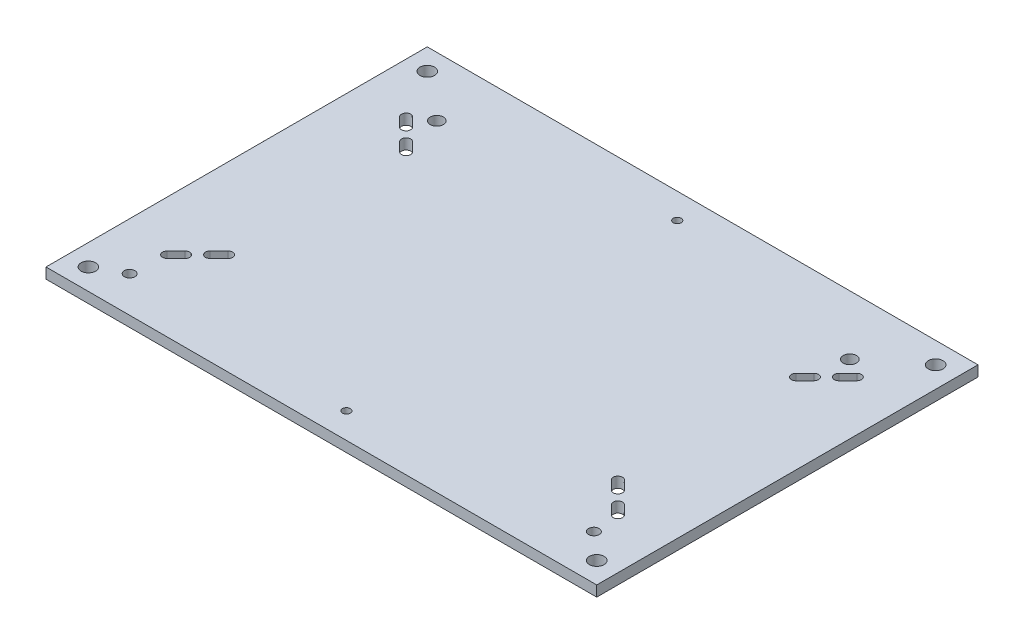
from build123d import *

# Parameters (mm, degrees)
SKETCH1_W                      = 330.2
SKETCH1_H                      = 228.6
BASE_PLATE_DEPTH               = 6.35
SLOTS_DEPTH                    = 402.659460862
FEET_CONNECTION_HOLE_D         = 8.7376
F_1_4_0_25_DIAMETER_HOLE1_D    = 6.35
F_5_16_0_3125_DIAMETER_HOLE1_D = 7.9375
ESD_CONNECTION_HOLE_D          = 4.7625


with BuildPart() as part:
    # Sketch1 → base plate (new body)
    with BuildSketch(Plane(origin=(0, 0, 0), x_dir=(1, 0, 0), z_dir=(0, 1, 0))):
        with Locations((165.1, -114.3)):
            Rectangle(SKETCH1_W, SKETCH1_H)
    extrude(amount=-BASE_PLATE_DEPTH)

    # Sketch3 → slots (cut, through all)
    with BuildSketch(Plane(origin=(0, 0, 0), x_dir=(1, 0, 0), z_dir=(0, 1, 0))):
        with BuildLine():
            Line((33.404828058, -178.606084521), (28.016674385, -183.994238194))
            ThreePointArc((28.016674385, -183.994238194), (28.016674385, -187.883325615), (31.905761806, -187.883325615))
            Line((31.905761806, -187.883325615), (37.293915479, -182.495171942))
            ThreePointArc((37.293915479, -182.495171942), (37.293915479, -178.606084521), (33.404828058, -178.606084521))
        make_face()
        with BuildLine():
            Line((44.775105348, -175.013982073), (50.163259021, -169.6258284))
            ThreePointArc((50.163259021, -169.6258284), (50.163259021, -165.736740979), (46.2741716, -165.736740979))
            Line((46.2741716, -165.736740979), (40.886017927, -171.124894652))
            ThreePointArc((40.886017927, -171.124894652), (40.886017927, -175.013982073), (44.775105348, -175.013982073))
        make_face()
        with BuildLine():
            ThreePointArc((31.905761806, -40.716674385), (28.016674385, -40.716674385), (28.016674385, -44.605761806))
            Line((28.016674385, -44.605761806), (33.404828058, -49.993915479))
            ThreePointArc((33.404828058, -49.993915479), (37.293915479, -49.993915479), (37.293915479, -46.104828058))
            Line((37.293915479, -46.104828058), (31.905761806, -40.716674385))
        make_face()
        with BuildLine():
            ThreePointArc((46.2741716, -62.863259021), (50.163259021, -62.863259021), (50.163259021, -58.9741716))
            Line((50.163259021, -58.9741716), (44.775105348, -53.586017927))
            ThreePointArc((44.775105348, -53.586017927), (40.886017927, -53.586017927), (40.886017927, -57.475105348))
            Line((40.886017927, -57.475105348), (46.2741716, -62.863259021))
        make_face()
        with BuildLine():
            Line((296.795171942, -49.993915479), (302.183325615, -44.605761806))
            ThreePointArc((302.183325615, -44.605761806), (302.183325615, -40.716674385), (298.294238194, -40.716674385))
            Line((298.294238194, -40.716674385), (292.906084521, -46.104828058))
            ThreePointArc((292.906084521, -46.104828058), (292.906084521, -49.993915479), (296.795171942, -49.993915479))
        make_face()
        with BuildLine():
            Line((285.424894652, -53.586017927), (280.036740979, -58.9741716))
            ThreePointArc((280.036740979, -58.9741716), (280.036740979, -62.863259021), (283.9258284, -62.863259021))
            Line((283.9258284, -62.863259021), (289.313982073, -57.475105348))
            ThreePointArc((289.313982073, -57.475105348), (289.313982073, -53.586017927), (285.424894652, -53.586017927))
        make_face()
        with BuildLine():
            ThreePointArc((283.9258284, -165.736740979), (280.036740979, -165.736740979), (280.036740979, -169.6258284))
            Line((280.036740979, -169.6258284), (285.424894652, -175.013982073))
            ThreePointArc((285.424894652, -175.013982073), (289.313982073, -175.013982073), (289.313982073, -171.124894652))
            Line((289.313982073, -171.124894652), (283.9258284, -165.736740979))
        make_face()
        with BuildLine():
            ThreePointArc((298.294238194, -187.883325615), (302.183325615, -187.883325615), (302.183325615, -183.994238194))
            Line((302.183325615, -183.994238194), (296.795171942, -178.606084521))
            ThreePointArc((296.795171942, -178.606084521), (292.906084521, -178.606084521), (292.906084521, -182.495171942))
            Line((292.906084521, -182.495171942), (298.294238194, -187.883325615))
        make_face()
    extrude(amount=-SLOTS_DEPTH, mode=Mode.SUBTRACT)

    # Feet connection hole (through all)
    with Locations(Plane(origin=(0, 0, 0), x_dir=(1, 0, 0), z_dir=(0, 1, 0))):
        with Locations((12.7, -215.9), (317.5, -12.7), (317.5, -215.9), (12.7, -12.7)):
            Hole(FEET_CONNECTION_HOLE_D / 2)

    # 1/4 (0.25) Diameter Hole1 (through all)
    with Locations(Plane(origin=(0, 0, 0), x_dir=(1, 0, 0), z_dir=(0, 1, 0))):
        with Locations((28.575, -207.01), (301.625, -201.726616716)):
            Hole(F_1_4_0_25_DIAMETER_HOLE1_D / 2)

    # 5/16 (0.3125) Diameter Hole1 (through all)
    with Locations(Plane(origin=(0, 0, 0), x_dir=(1, 0, 0), z_dir=(0, 1, 0))):
        with Locations((41.275, -35.56), (288.925, -35.56)):
            Hole(F_5_16_0_3125_DIAMETER_HOLE1_D / 2)

    # ESD Connection hole (through all)
    with Locations(Plane(origin=(0, 0, 0), x_dir=(1, 0, 0), z_dir=(0, 1, 0))):
        with Locations((165.1, -15.24), (164.768662044, -213.266978445)):
            Hole(ESD_CONNECTION_HOLE_D / 2)


solid = part.part
